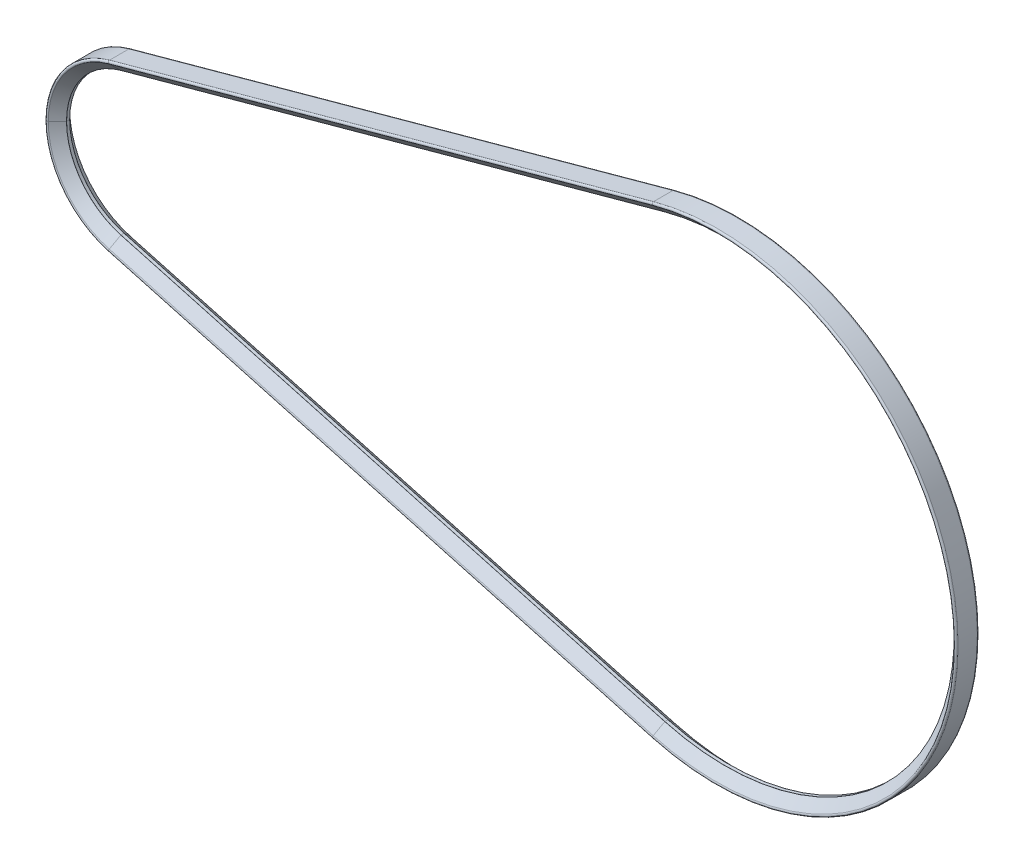
from build123d import *

# Parameters (mm, degrees)
FILLET1_R = 0.1
FILLET2_R = 0.01


with BuildPart() as part:
    # Sweep1: sweep along a path in Sketch2
    with BuildLine(Plane.XY) as sweep1_path:
        Line((-38.238243243, 4.508034901), (-3.833918919, 13.958033197))
        ThreePointArc((-3.833918919, 13.958033197), (14.475, 0), (-3.833918919, -13.958033197))
        Line((-3.833918919, -13.958033197), (-38.238243243, -4.508034901))
        ThreePointArc((-38.238243243, -4.508034901), (-41.675, 0), (-38.238243243, 4.508034901))
    # Sketch3 → Sweep1 (sweep)
    with BuildSketch(Plane(origin=(0, 0, 0), x_dir=(1, 0, 0), z_dir=(0, 1, 0))):
        Polygon((-42.425, 0.85), (-42.425, -0.85), (-41.675, -0.1), (-41.675, 0.1), align=None)
    sweep(path=sweep1_path.line)

    # Fillet1
    fillet1_edges = [part.edges().sort_by_distance(p)[0] for p in [
        (-21.23472973, -9.956248204, -0.85),
        (-21.23472973, -9.956248204, 0.85),
        (-42.425, 0, -0.85),
        (-42.425, 0, 0.85),
        (-42.425, 0, -0.85),
        (-42.425, 0, 0.85),
        (-21.23472973, 9.956248204, -0.85),
        (-21.23472973, 9.956248204, 0.85),
        (15.225, 0, -0.85),
        (15.225, 0, 0.85),
    ]]
    fillet(fillet1_edges, radius=FILLET1_R)

    # Fillet2
    # the kernel refuses this fillet: 0.01 mm, written as the material it takes off along each edge
    with BuildSketch(Plane(origin=(-3.833918919, -13.958033197, 0.1), x_dir=(-0.18728774204254256, -0.6818528445936296, 0.707106781186676), z_dir=(-0.9642855403669122, 0.26486486486374966, 9.376666110227916e-13)), Plane(origin=(-38.238243243, 4.508034901, 0.1), x_dir=(-0.18728774204547696, 0.681852844593033, 0.7071067811864742), z_dir=(0.9642855403662898, 0.26486486486601535, 9.378886556277166e-13))) as fillet2_piece_1:
        with BuildLine():
            CenterArc((FILLET2_R * 0.414213562373, -FILLET2_R), FILLET2_R, 90, 45)
            Line((-FILLET2_R * 0.292893218814, -FILLET2_R * 0.292893218813), (0, 0))
            Line((0, 0), (FILLET2_R * 0.414213562373, 0))
        make_face()
    extrude(amount=35.678564994, mode=Mode.SUBTRACT)
    with BuildSketch(Plane(origin=(-37, 0, -0.1), x_dir=(-0.26486486486465444, -0.9642855403666637, 0), z_dir=(0.9642855403666637, -0.26486486486465444, 0))) as fillet2_piece_2:
        with BuildLine():
            CenterArc((4.675 + FILLET2_R, -FILLET2_R * 0.414213562373), FILLET2_R, 135, 45)
            Line((4.675, -FILLET2_R * 0.414213562373), (4.675, 0))
            Line((4.675, 0), (4.675 + FILLET2_R * 0.292893218813, FILLET2_R * 0.292893218813))
        make_face()
    revolve(axis=Axis((-37, 0, -0.1), (0, 0, -1)), revolution_arc=149.282153594, mode=Mode.SUBTRACT)
    with BuildSketch(Plane(origin=(-37, 0, 0.1), x_dir=(-0.264864864864405, -0.9642855403667321, 0), z_dir=(0.9642855403667321, -0.264864864864405, 0))) as fillet2_piece_3:
        with BuildLine():
            CenterArc((4.675 + FILLET2_R, FILLET2_R * 0.414213562373), FILLET2_R, 180, 45)
            Line((4.675, FILLET2_R * 0.414213562373), (4.675, 0))
            Line((4.675, 0), (4.675 + FILLET2_R * 0.292893218813, -FILLET2_R * 0.292893218814))
        make_face()
    revolve(axis=Axis((-37, 0, 0.1), (0, 0, -1)), revolution_arc=149.282153594, mode=Mode.SUBTRACT)
    with BuildSketch(Plane(origin=(-38.238243243, 4.508034901, -0.1), x_dir=(-0.18728774204415874, 0.6818528445932414, -0.7071067811866223), z_dir=(0.9642855403665382, 0.264864864865111, 0)), Plane(origin=(-3.833918919, -13.958033197, -0.1), x_dir=(-0.1872877420438419, -0.6818528445933534, -0.7071067811865981), z_dir=(-0.9642855403666637, 0.2648648648646539, 0))) as fillet2_piece_4:
        with BuildLine():
            CenterArc((FILLET2_R * 0.414213562373, FILLET2_R), FILLET2_R, 225, 45)
            Line((-FILLET2_R * 0.292893218813, FILLET2_R * 0.292893218813), (0, 0))
            Line((0, 0), (FILLET2_R * 0.414213562373, 0))
        make_face()
    extrude(amount=35.678564994, mode=Mode.SUBTRACT)
    with BuildSketch(Plane(origin=(0, 0, -0.1), x_dir=(-0.2648648648651112, 0.9642855403665381, 0), z_dir=(-0.9642855403665381, -0.2648648648651112, 0))) as fillet2_piece_5:
        with BuildLine():
            CenterArc((14.475 + FILLET2_R, -FILLET2_R * 0.414213562373), FILLET2_R, 135, 45)
            Line((14.475, -FILLET2_R * 0.414213562373), (14.475, 0))
            Line((14.475, 0), (14.475 + FILLET2_R * 0.292893218814, FILLET2_R * 0.292893218813))
        make_face()
    revolve(axis=Axis((0, 0, -0.1), (0, 0, -1)), revolution_arc=210.717846406, mode=Mode.SUBTRACT)
    with BuildSketch(Plane(origin=(0, 0, 0.1), x_dir=(-0.2648648648652003, 0.9642855403665136, 0), z_dir=(-0.9642855403665136, -0.2648648648652003, 0))) as fillet2_piece_6:
        with BuildLine():
            CenterArc((14.475 + FILLET2_R, FILLET2_R * 0.414213562373), FILLET2_R, 180, 45)
            Line((14.475, FILLET2_R * 0.414213562373), (14.475, 0))
            Line((14.475, 0), (14.475 + FILLET2_R * 0.292893218814, -FILLET2_R * 0.292893218814))
        make_face()
    revolve(axis=Axis((0, 0, 0.1), (0, 0, -1)), revolution_arc=210.717846406, mode=Mode.SUBTRACT)


solid = part.part
